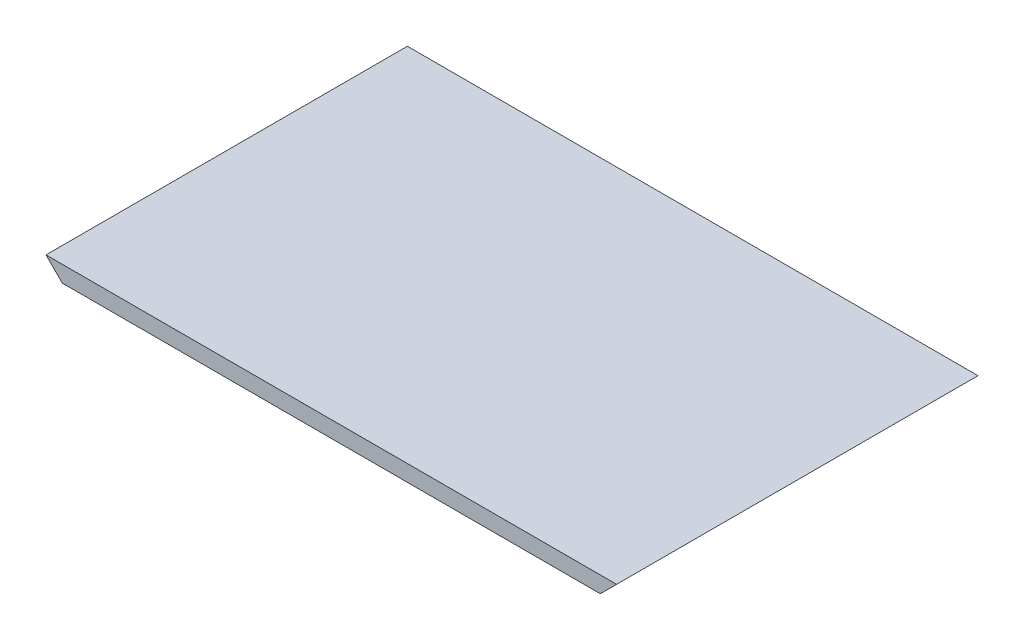
from build123d import *

# Parameters (mm, degrees)
SKETCH1_W           = 210
SKETCH1_H           = 133
BOSS_EXTRUDE1_DEPTH = 6
CHAMFER1_SIZE       = 6


with BuildPart() as part:
    # Sketch1 → Boss-Extrude1 (new body)
    with BuildSketch(Plane(origin=(0, 0, 0), x_dir=(1, 0, 0), z_dir=(0, 1, 0))):
        Rectangle(SKETCH1_W, SKETCH1_H)
    extrude(amount=BOSS_EXTRUDE1_DEPTH)

    # Chamfer1
    chamfer1_edges = [part.edges().sort_by_distance(p)[0] for p in [
        (105, 0, 0),
        (-105, 0, 0),
    ]]
    chamfer(chamfer1_edges, length=CHAMFER1_SIZE - 0.0001)  # a hair under: the kernel refuses the full size


solid = part.part
